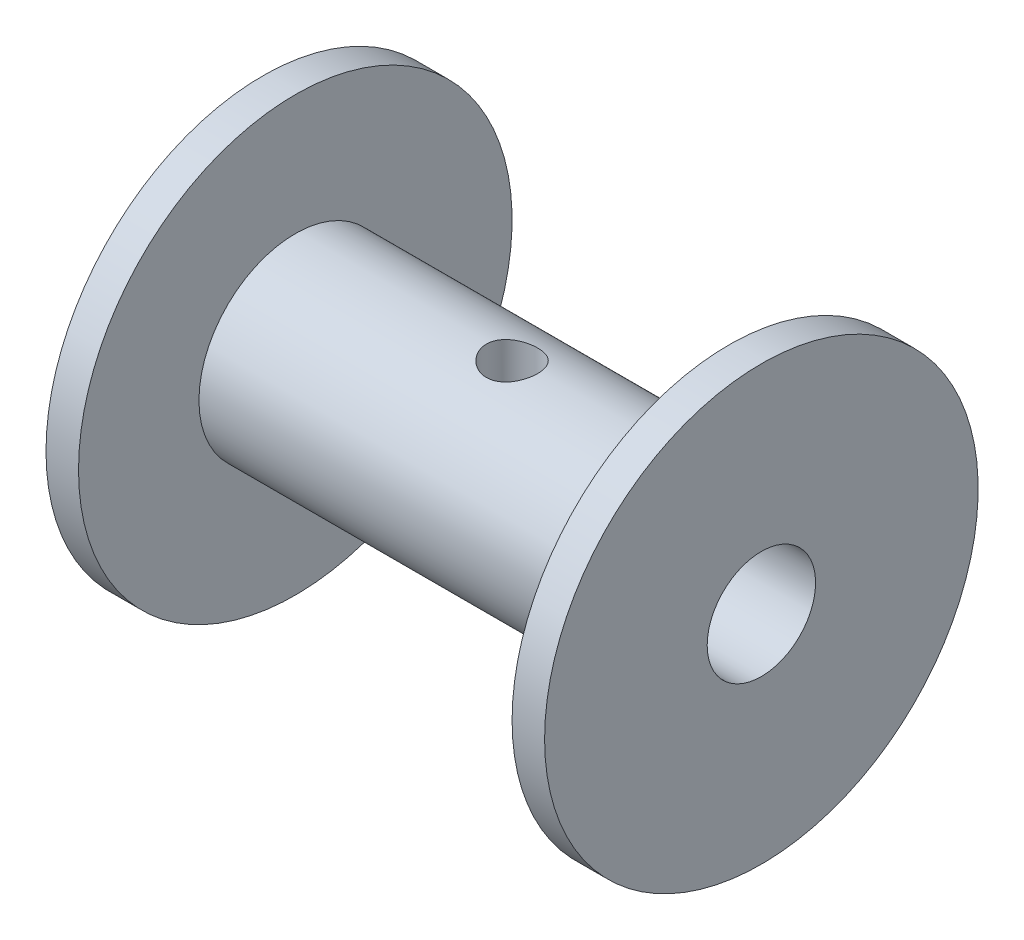
from build123d import *

# Parameters (mm, degrees)
SKETCH2_R          = 1.5
CUT_EXTRUDE1_DEPTH = 24.14921219


with BuildPart() as part:
    # Sketch1 → Revolve1 (revolve)
    with BuildSketch(Plane.XY):
        Polygon((14.605, 3.175), (14.605, 12.7), (12.7, 12.7), (12.7, 5.64515), (-12.7, 5.64515), (-12.7, 12.7), (-14.605, 12.7), (-14.605, 3.175), align=None)
    revolve(axis=Axis((-15.275524476, 0, 0), (1, 0, 0)))

    # Sketch2 → Cut-Extrude1 (cut, through all)
    with BuildSketch(Plane(origin=(0, 0, 0), x_dir=(1, 0, 0), z_dir=(0, 1, 0))):
        Circle(SKETCH2_R)
    extrude(amount=CUT_EXTRUDE1_DEPTH, mode=Mode.SUBTRACT)


solid = part.part
